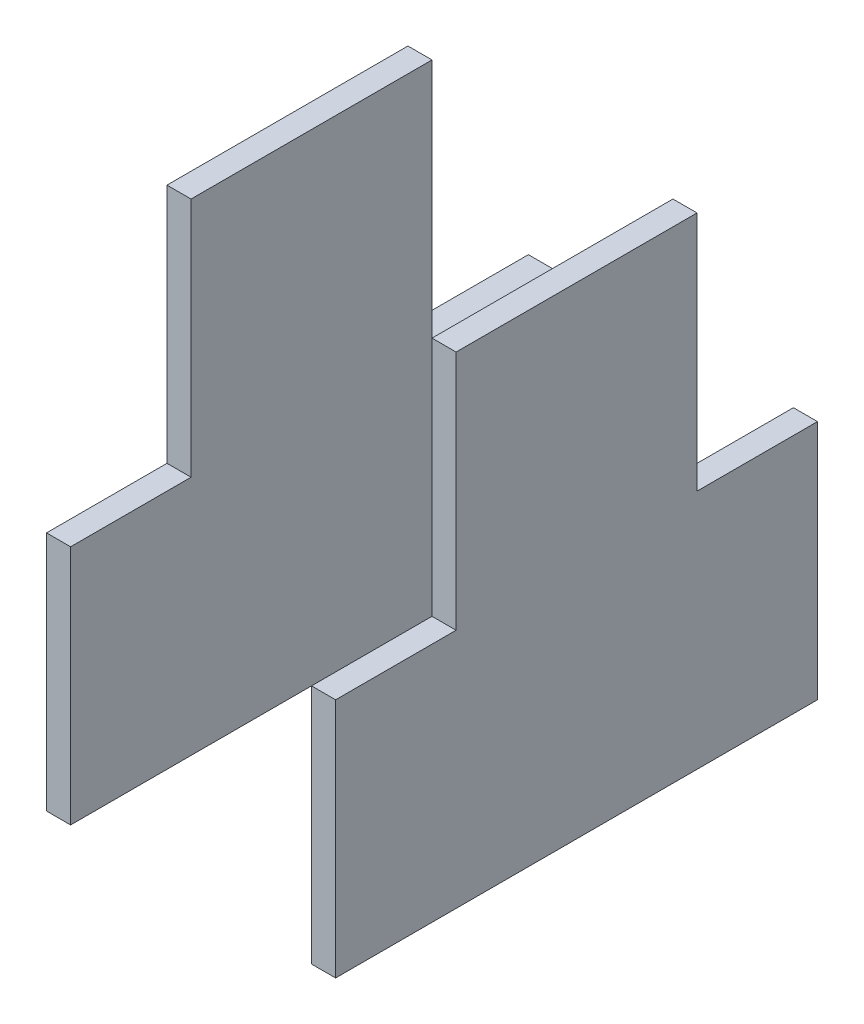
from build123d import *

# Parameters (mm, degrees)
SKETCH1_W           = 12.7
SKETCH1_H           = 152.4
BOSS_EXTRUDE1_DEPTH = 25.4
SKETCH6_W           = 50.8
SKETCH6_H           = 25.4
BOSS_EXTRUDE5_DEPTH = 2.54
SKETCH7_W           = 2.54
SKETCH7_H           = 25.4
BOSS_EXTRUDE6_DEPTH = 25.4
SKETCH8_W           = 25.4
SKETCH8_H           = 25.4
CUT_EXTRUDE1_DEPTH  = 170.18


with BuildPart() as part:
    # Sketch1 → Boss-Extrude1 (new body)
    with BuildSketch(Plane(origin=(0, 0, 0), x_dir=(1, 0, 0), z_dir=(0, 1, 0))):
        with Locations((6.35, 76.2)):
            Rectangle(SKETCH1_W, SKETCH1_H)
    boss_extrude1 = extrude(amount=BOSS_EXTRUDE1_DEPTH)

    # Sketch6 → Boss-Extrude5 (add)
    with BuildSketch(Plane(origin=(12.7, 0, 0), x_dir=(0, 0, -1), z_dir=(1, 0, 0))):
        with Locations((127, 12.7)):
            Rectangle(SKETCH6_W, SKETCH6_H)
    boss_extrude5 = extrude(amount=BOSS_EXTRUDE5_DEPTH)

    # Sketch7 → Boss-Extrude6 (add)
    with BuildSketch(Plane(origin=(0, 25.4, 0), x_dir=(1, 0, 0), z_dir=(0, 1, 0))):
        with Locations((13.97, 127)):
            Rectangle(SKETCH7_W, SKETCH7_H)
    boss_extrude6 = extrude(amount=BOSS_EXTRUDE6_DEPTH)

    # Mirror1: Boss-Extrude1, Boss-Extrude5, Boss-Extrude6 across plane
    add(boss_extrude1.mirror(Plane(origin=(0, 25.4, 0), x_dir=(0, 0, 1), z_dir=(1, 0, 0))))
    add(boss_extrude5.mirror(Plane(origin=(0, 25.4, 0), x_dir=(0, 0, 1), z_dir=(1, 0, 0))))
    add(boss_extrude6.mirror(Plane(origin=(0, 25.4, 0), x_dir=(0, 0, 1), z_dir=(1, 0, 0))))

    # Sketch8 → Cut-Extrude1 (cut)
    with BuildSketch(Plane.XY):
        with Locations((0, 12.7)):
            Rectangle(SKETCH8_W, SKETCH8_H)
    extrude(amount=-CUT_EXTRUDE1_DEPTH, mode=Mode.SUBTRACT)


with BuildPart() as cut_extrude1_piece_1:
    # of the separate pieces the step leaves, piece 1, a body of its own (cut_extrude1_pieces)
    add(part.part.solids().sort_by_distance((-12.7, 0, -101.6))[0])


with BuildPart() as cut_extrude1_piece_2:
    # of the separate pieces the step leaves, piece 2, a body of its own (cut_extrude1_pieces)
    add(part.part.solids().sort_by_distance((12.7, 0, -101.6))[0])


solid = Compound([cut_extrude1_piece_1.part, cut_extrude1_piece_2.part])
